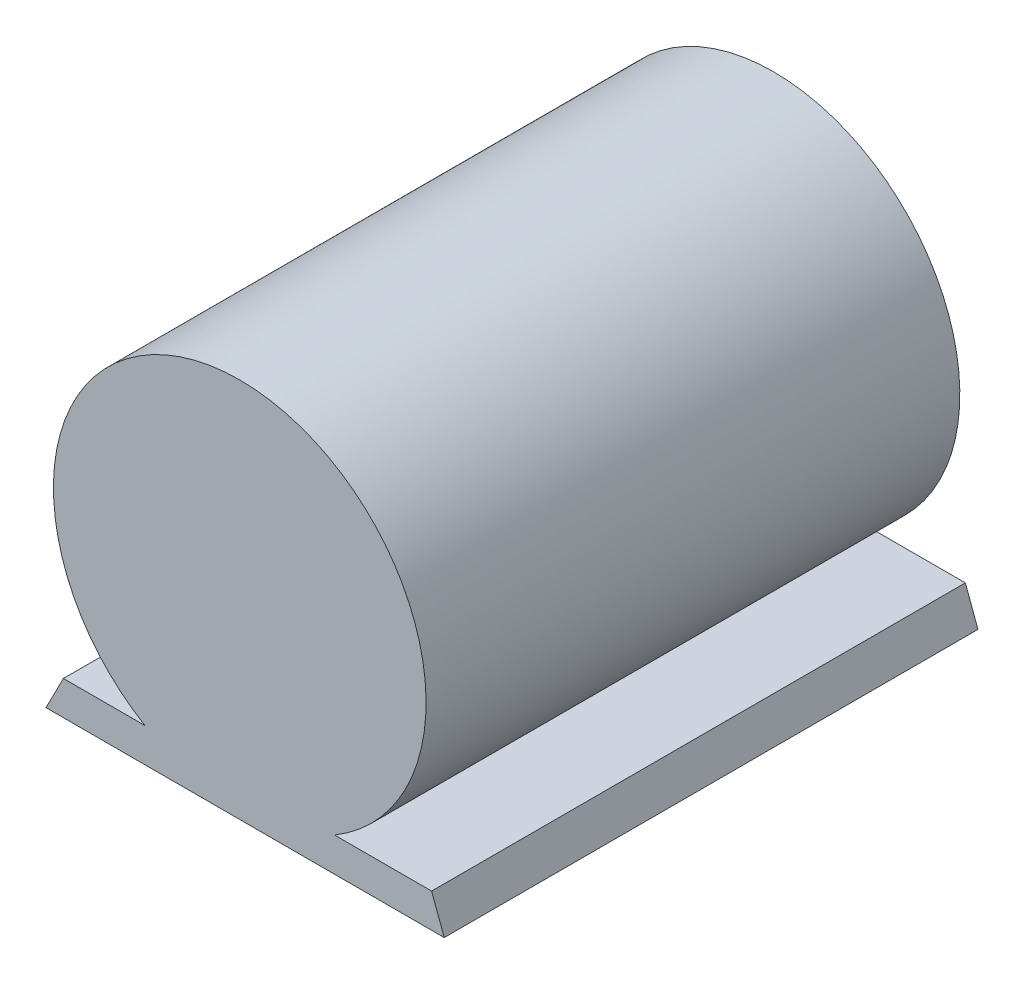
from build123d import *

# Parameters (mm, degrees)
EXTRUDE_2_DEPTH     = 192
SKETCH_5_R          = 60
CUT_EXTRUDE_2_DEPTH = 167
SKETCH_6_R          = 65
CUT_EXTRUDE_3_DEPTH = 167
EXTRUDE_3_DEPTH     = 81
SKETCH_8_W          = 31.710893006
SKETCH_8_H          = 3.805307161
EXTRUDE_4_DEPTH     = 7
SKETCH_9_W          = 9.753754566
SKETCH_9_H          = 1.960413463
CUT_EXTRUDE_4_DEPTH = 3
FILLET_1_R          = 3
EXTRUDE_5_DEPTH     = 3


with BuildPart() as part:
    # 草图4 → 凸台-拉伸2 (new body)
    with BuildSketch(Plane.XY):
        with BuildLine():
            Line((-63.444815749, -57.709462621), (-34.077926376, -57.709462621))
            ThreePointArc((-34.077926376, -57.709462621), (0, 67.020050299), (34.077926376, -57.709462621))
            Line((34.077926376, -57.709462621), (69.007018872, -57.709462621))
            Line((69.007018872, -57.709462621), (73.554721348, -69.931413026))
            Line((73.554721348, -69.931413026), (-69.697906654, -69.931413026))
            Line((-69.697906654, -69.931413026), (-63.444815749, -57.709462621))
        make_face()
    extrude(amount=EXTRUDE_2_DEPTH)

    # 草图5 → 切除-拉伸2 (cut)
    with BuildSketch(Plane(origin=(0, 0, 0), x_dir=(-1, 0, 0), z_dir=(0, 0, -1))):
        Circle(SKETCH_5_R)
    extrude(amount=-CUT_EXTRUDE_2_DEPTH, mode=Mode.SUBTRACT)

    # 草图6 → 切除-拉伸3 (cut)
    with BuildSketch(Plane(origin=(0, 0, 0), x_dir=(-1, 0, 0), z_dir=(0, 0, -1))):
        Circle(SKETCH_6_R)
    extrude(amount=-CUT_EXTRUDE_3_DEPTH, mode=Mode.SUBTRACT)

    # 草图7 → 凸台-拉伸3 (add)
    with BuildSketch(Plane(origin=(0, 0, 0), x_dir=(-1, 0, 0), z_dir=(0, 0, -1))):
        with BuildLine():
            Line((-47.897732915, -41.016239679), (-50.424875633, -41.016239679))
            ThreePointArc((-50.424875633, -41.016239679), (0, -65), (50.424875633, -41.016239679))
            Line((50.424875633, -41.016239679), (47.897732915, -41.016239679))
            ThreePointArc((47.897732915, -41.016239679), (0, -63.059691846), (-47.897732915, -41.016239679))
        make_face()
    extrude(amount=-EXTRUDE_3_DEPTH)

    # 草图8 → 凸台-拉伸4 (add)
    with BuildSketch(Plane(origin=(0, 0, 0), x_dir=(-1, 0, 0), z_dir=(0, 0, -1))):
        with Locations((0.108672156, -65.494898904)):
            Rectangle(SKETCH_8_W, SKETCH_8_H)
    extrude(amount=EXTRUDE_4_DEPTH)

    # 草图9 → 切除-拉伸4 (cut)
    with BuildSketch(Plane(origin=(0, 0, -7), x_dir=(-1, 0, 0), z_dir=(0, 0, -1))):
        with Locations((0, -65.811506795)):
            Rectangle(SKETCH_9_W, SKETCH_9_H)
    extrude(amount=-CUT_EXTRUDE_4_DEPTH, mode=Mode.SUBTRACT)

    # 圆角1
    # the kernel refuses this fillet: 3 mm, written as the material it takes off along each edge
    with BuildSketch(Plane(origin=(-4.876877283, -66.791713526, -7), x_dir=(-1, 0, 0), z_dir=(0, 1, 0)), Plane(origin=(4.876877283, -64.831300063, -7), x_dir=(1, 0, 0), z_dir=(0, -1, 0))) as fillet_1_piece_1:
        with BuildLine():
            CenterArc((FILLET_1_R, FILLET_1_R), FILLET_1_R, 180, 90)
            Line((0, FILLET_1_R), (-FILLET_1_R * 0.02, FILLET_1_R))
            Line((-FILLET_1_R * 0.02, FILLET_1_R), (-FILLET_1_R * 0.02, -FILLET_1_R * 0.02))
            Line((-FILLET_1_R * 0.02, -FILLET_1_R * 0.02), (FILLET_1_R, -FILLET_1_R * 0.02))
            Line((FILLET_1_R, -FILLET_1_R * 0.02), (FILLET_1_R, 0))
        make_face()
    extrude(amount=1.960413463, mode=Mode.SUBTRACT)
    with BuildSketch(Plane(origin=(-4.876877283, -64.831300063, -7), x_dir=(0, 1, 0), z_dir=(1, 0, 0))) as fillet_1_piece_2:
        with BuildLine():
            CenterArc((FILLET_1_R, FILLET_1_R), FILLET_1_R, 180, 90)
            Line((0, FILLET_1_R), (-FILLET_1_R * 0.02, FILLET_1_R))
            Line((-FILLET_1_R * 0.02, FILLET_1_R), (-FILLET_1_R * 0.02, -FILLET_1_R * 0.02))
            Line((-FILLET_1_R * 0.02, -FILLET_1_R * 0.02), (FILLET_1_R, -FILLET_1_R * 0.02))
            Line((FILLET_1_R, -FILLET_1_R * 0.02), (FILLET_1_R, 0))
        make_face()
    extrude(amount=9.753754565, mode=Mode.SUBTRACT)
    with BuildSketch(Plane(origin=(-12.376877283, -64.831300063, -7), x_dir=(0, 1, 0), z_dir=(1, 0, 0))) as fillet_1_piece_3a_section:
        with BuildLine():
            CenterArc((FILLET_1_R, FILLET_1_R), FILLET_1_R, 180, 90)
            Line((0, FILLET_1_R), (-FILLET_1_R * 0.02, FILLET_1_R))
            Line((-FILLET_1_R * 0.02, FILLET_1_R), (-FILLET_1_R * 0.02, -FILLET_1_R * 0.02))
            Line((-FILLET_1_R * 0.02, -FILLET_1_R * 0.02), (FILLET_1_R, -FILLET_1_R * 0.02))
            Line((FILLET_1_R, -FILLET_1_R * 0.02), (FILLET_1_R, 0))
        make_face()
    fillet_1_piece_3a = extrude(amount=17.253754565, mode=Mode.PRIVATE)
    fillet_1_piece_3a = split(fillet_1_piece_3a, bisect_by=Plane(origin=(-4.876877283, -64.15211472, -6.320814657), z_dir=(-1, 0, 0)), keep=Keep.TOP, mode=Mode.PRIVATE)
    with BuildSketch(Plane(origin=(-4.876877283, -66.791713526, -7), x_dir=(-1, 0, 0), z_dir=(0, 1, 0))) as fillet_1_piece_3b_section:
        with BuildLine():
            CenterArc((FILLET_1_R, FILLET_1_R), FILLET_1_R, 180, 90)
            Line((0, FILLET_1_R), (-FILLET_1_R * 0.02, FILLET_1_R))
            Line((-FILLET_1_R * 0.02, FILLET_1_R), (-FILLET_1_R * 0.02, -FILLET_1_R * 0.02))
            Line((-FILLET_1_R * 0.02, -FILLET_1_R * 0.02), (FILLET_1_R, -FILLET_1_R * 0.02))
            Line((FILLET_1_R, -FILLET_1_R * 0.02), (FILLET_1_R, 0))
        make_face()
    fillet_1_piece_3b = extrude(amount=9.460413463, mode=Mode.PRIVATE)
    fillet_1_piece_3b = split(fillet_1_piece_3b, bisect_by=Plane(origin=(-5.556062626, -64.831300063, -6.320814657), z_dir=(0, 1, 0)), keep=Keep.TOP, mode=Mode.PRIVATE)
    fillet_1_piece_3 = fillet_1_piece_3a & fillet_1_piece_3b
    add(fillet_1_piece_3, mode=Mode.SUBTRACT)
    with BuildSketch(Plane(origin=(4.876877283, -57.331300063, -7), x_dir=(1, 0, 0), z_dir=(0, -1, 0))) as fillet_1_piece_4a_section:
        with BuildLine():
            CenterArc((FILLET_1_R, FILLET_1_R), FILLET_1_R, 180, 90)
            Line((0, FILLET_1_R), (-FILLET_1_R * 0.02, FILLET_1_R))
            Line((-FILLET_1_R * 0.02, FILLET_1_R), (-FILLET_1_R * 0.02, -FILLET_1_R * 0.02))
            Line((-FILLET_1_R * 0.02, -FILLET_1_R * 0.02), (FILLET_1_R, -FILLET_1_R * 0.02))
            Line((FILLET_1_R, -FILLET_1_R * 0.02), (FILLET_1_R, 0))
        make_face()
    fillet_1_piece_4a = extrude(amount=9.460413463, mode=Mode.PRIVATE)
    fillet_1_piece_4a = split(fillet_1_piece_4a, bisect_by=Plane(origin=(5.556062626, -64.831300063, -6.320814657), z_dir=(0, 1, 0)), keep=Keep.TOP, mode=Mode.PRIVATE)
    with BuildSketch(Plane(origin=(-4.876877283, -64.831300063, -7), x_dir=(0, 1, 0), z_dir=(1, 0, 0))) as fillet_1_piece_4b_section:
        with BuildLine():
            CenterArc((FILLET_1_R, FILLET_1_R), FILLET_1_R, 180, 90)
            Line((0, FILLET_1_R), (-FILLET_1_R * 0.02, FILLET_1_R))
            Line((-FILLET_1_R * 0.02, FILLET_1_R), (-FILLET_1_R * 0.02, -FILLET_1_R * 0.02))
            Line((-FILLET_1_R * 0.02, -FILLET_1_R * 0.02), (FILLET_1_R, -FILLET_1_R * 0.02))
            Line((FILLET_1_R, -FILLET_1_R * 0.02), (FILLET_1_R, 0))
        make_face()
    fillet_1_piece_4b = extrude(amount=17.253754565, mode=Mode.PRIVATE)
    fillet_1_piece_4b = split(fillet_1_piece_4b, bisect_by=Plane(origin=(4.876877283, -64.15211472, -6.320814657), z_dir=(1, 0, 0)), keep=Keep.TOP, mode=Mode.PRIVATE)
    fillet_1_piece_4 = fillet_1_piece_4a & fillet_1_piece_4b
    add(fillet_1_piece_4, mode=Mode.SUBTRACT)

    # 草图10 → 凸台-拉伸5 (add)
    with BuildSketch(Plane.XY.offset(81)):
        with BuildLine():
            Line((-49.354840822, -43.055078484), (49.354840822, -43.055078484))
            ThreePointArc((49.354840822, -43.055078484), (0, -65.495344078), (-49.354840822, -43.055078484))
        make_face()
    extrude(amount=EXTRUDE_5_DEPTH)


solid = part.part
